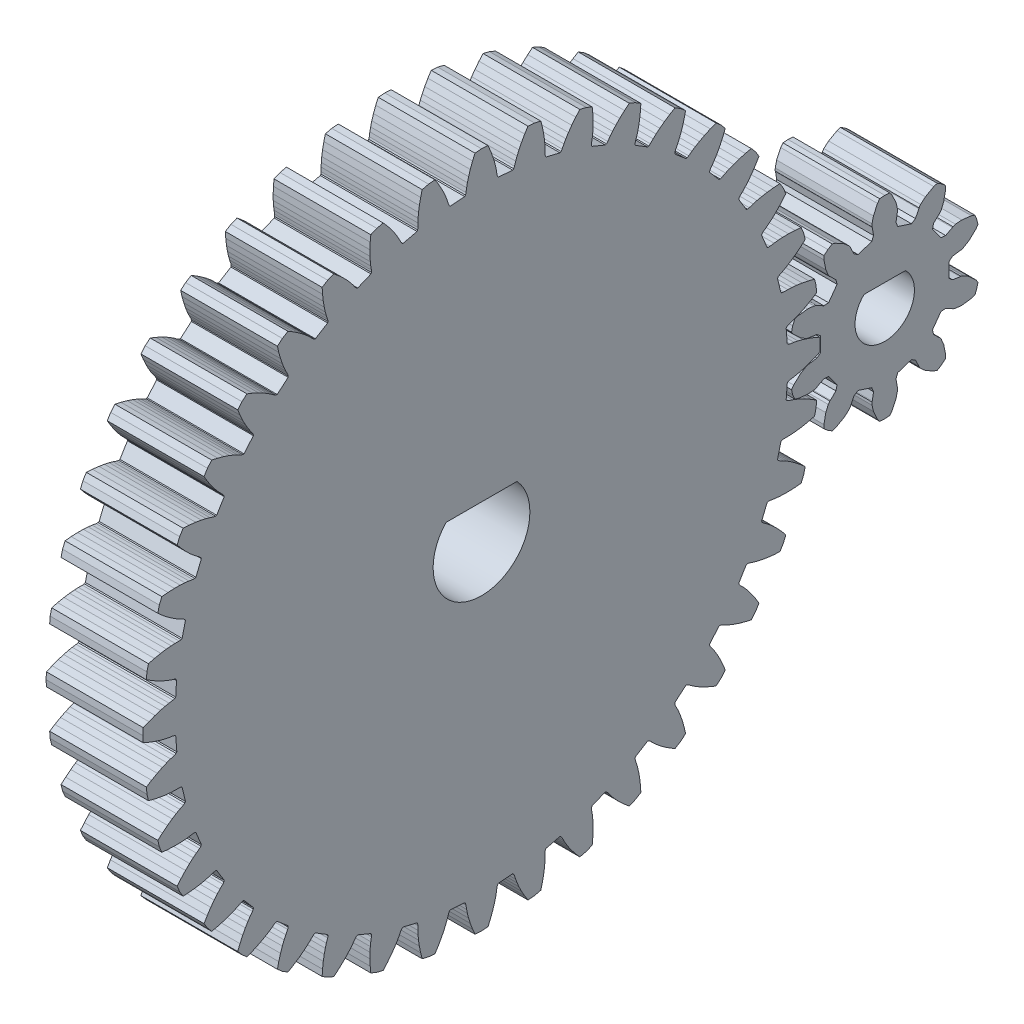
from build123d import *

# Parameters (mm, degrees)
BOSS_EXTRUDE1_DEPTH   = 6.35
BOSS_EXTRUDE1_2_DEPTH = 6.35


with BuildPart() as part:
    # Sketch1 → Boss-Extrude1 (new body)
    with BuildSketch(Plane(origin=(0, 0, 0), x_dir=(0, 0, -1), z_dir=(1, 0, 0))):
        Polygon((21.465245632, -3.994555744), (21.856281306, -3.89428781), (21.956333231, -3.47754155), (21.989959872, -3.050274559), (21.649047342, -2.834077419), (21.277026324, -2.624610686), (20.943763466, -2.459310064), (20.652727149, -2.333477623), (20.406996935, -2.242180601), (20.155632291, -2.163495755), (20.043799128, -2.107240426), (19.993019969, -2.048246673), (20.067289089, -1.104568025), (20.126671729, -1.054244194), (20.245928312, -1.016176023), (20.506507262, -0.977782011), (20.763494131, -0.926049682), (21.070631837, -0.847294558), (21.425650392, -0.736162857), (21.82585903, -0.587471917), (22.196395045, -0.427266991), (22.230021687, 0), (22.196395045, 0.427266991), (21.82585903, 0.587471917), (21.425650392, 0.736162857), (21.070631837, 0.847294558), (20.763494131, 0.926049682), (20.506507262, 0.977782011), (20.245928312, 1.016176023), (20.126671729, 1.054244194), (20.067289089, 1.104568025), (19.993019969, 2.048246673), (20.043799128, 2.107240426), (20.155632291, 2.163495755), (20.406996935, 2.242180601), (20.652727149, 2.333477623), (20.943763466, 2.459310064), (21.277026324, 2.624610686), (21.649047342, 2.834077419), (21.989959872, 3.050274559), (21.956333231, 3.47754155), (21.856281306, 3.89428781), (21.465245632, 3.994555744), (21.046703839, 4.078809628), (20.678671324, 4.133035975), (20.362994976, 4.162774571), (20.101079323, 4.173668386), (19.837702386, 4.170826175), (19.713958875, 4.189769823), (19.647434952, 4.230184593), (19.426456344, 5.150626741), (19.467381671, 5.216837794), (19.56903771, 5.289895087), (19.804998617, 5.406933286), (20.033421483, 5.535546964), (20.301190129, 5.705358309), (20.604491254, 5.920757604), (20.93916426, 6.185842363), (21.242058907, 6.452708226), (21.142006982, 6.869454486), (20.977993384, 7.265418339), (20.576086648, 7.303280351), (20.149517587, 7.321022569), (19.777533294, 7.31700833), (19.461091304, 7.296998134), (19.2006961, 7.266785193), (18.941006389, 7.222776744), (18.815822927, 7.222129415), (18.743795761, 7.251639978), (18.381548891, 8.126181285), (18.411612669, 8.197979301), (18.500588475, 8.286039646), (18.715335503, 8.438549329), (18.920826493, 8.601312768), (19.158734116, 8.810921699), (19.424605227, 9.07111582), (19.71368946, 9.385291338), (19.971107954, 9.696254802), (19.807094356, 10.092218655), (19.583157644, 10.457650156), (19.180276122, 10.432173959), (18.756183341, 10.382967637), (18.389406756, 10.320811657), (18.079990977, 10.251545385), (17.827528015, 10.180969631), (17.577919954, 10.096878578), (17.454378972, 10.076656211), (17.378622111, 10.094535919), (16.8840267, 10.901642276), (16.902488658, 10.977259351), (16.976593351, 11.078154409), (17.164838717, 11.262380281), (17.34233796, 11.455285706), (17.544526484, 11.699530954), (17.766420953, 11.998113059), (18.0027982, 12.353643292), (18.208402042, 12.701047404), (17.98446533, 13.066478905), (17.706119569, 13.392379919), (17.312183543, 13.30419282), (16.901009612, 13.189249583), (16.548471993, 13.070482347), (16.253701268, 12.953665566), (16.015387024, 12.844464809), (15.782006791, 12.722361753), (15.663150279, 12.683062289), (15.585529109, 12.688870884), (14.970763736, 13.408668654), (14.977169281, 13.486242844), (15.034578158, 13.597488244), (15.191686634, 13.808894053), (15.336823511, 14.027191491), (15.498314384, 14.300058928), (15.670768432, 14.629676935), (15.848618301, 15.017807549), (15.997344841, 15.393098067), (15.71899908, 15.71899908), (15.393098067, 15.997344841), (15.017807549, 15.848618301), (14.629676935, 15.670768432), (14.300058928, 15.498314384), (14.027191491, 15.336823511), (13.808894053, 15.191686634), (13.597488244, 15.034578158), (13.486242844, 14.977169281), (13.408668654, 14.970763736), (12.688870884, 15.585529109), (12.683062289, 15.663150279), (12.722361753, 15.782006791), (12.844464809, 16.015387024), (12.953665566, 16.253701268), (13.070482347, 16.548471993), (13.189249583, 16.901009612), (13.30419282, 17.312183543), (13.392379919, 17.706119569), (13.066478905, 17.98446533), (12.701047404, 18.208402042), (12.353643292, 18.0027982), (11.998113059, 17.766420953), (11.699530954, 17.544526484), (11.455285706, 17.34233796), (11.262380281, 17.164838717), (11.078154409, 16.976593351), (10.977259351, 16.902488658), (10.901642276, 16.8840267), (10.094535919, 17.378622111), (10.076656211, 17.454378972), (10.096878578, 17.577919954), (10.180969631, 17.827528015), (10.251545385, 18.079990977), (10.320811657, 18.389406756), (10.382967637, 18.756183341), (10.432173959, 19.180276122), (10.457650156, 19.583157644), (10.092218655, 19.807094356), (9.696254802, 19.971107954), (9.385291338, 19.71368946), (9.07111582, 19.424605227), (8.810921699, 19.158734116), (8.601312768, 18.920826493), (8.438549329, 18.715335503), (8.286039646, 18.500588475), (8.197979301, 18.411612669), (8.126181285, 18.381548891), (7.251639978, 18.743795761), (7.222129415, 18.815822927), (7.222776744, 18.941006389), (7.266785193, 19.2006961), (7.296998134, 19.461091304), (7.31700833, 19.777533294), (7.321022569, 20.149517587), (7.303280351, 20.576086648), (7.265418339, 20.977993384), (6.869454486, 21.142006982), (6.452708226, 21.242058907), (6.185842363, 20.93916426), (5.920757604, 20.604491254), (5.705358309, 20.301190129), (5.535546964, 20.033421483), (5.406933286, 19.804998617), (5.289895087, 19.56903771), (5.216837794, 19.467381671), (5.150626741, 19.426456344), (4.230184593, 19.647434952), (4.189769823, 19.713958875), (4.170826175, 19.837702386), (4.173668386, 20.101079323), (4.162774571, 20.362994976), (4.133035975, 20.678671324), (4.078809628, 21.046703839), (3.994555744, 21.465245632), (3.89428781, 21.856281306), (3.47754155, 21.956333231), (3.050274559, 21.989959872), (2.834077419, 21.649047342), (2.624610686, 21.277026324), (2.459310064, 20.943763466), (2.333477623, 20.652727149), (2.242180601, 20.406996935), (2.163495755, 20.155632291), (2.107240426, 20.043799128), (2.048246673, 19.993019969), (1.104568025, 20.067289089), (1.054244194, 20.126671729), (1.016176023, 20.245928312), (0.977782011, 20.506507262), (0.926049682, 20.763494131), (0.847294558, 21.070631837), (0.736162857, 21.425650392), (0.587471917, 21.82585903), (0.427266991, 22.196395045), (0, 22.230021687), (-0.427266991, 22.196395045), (-0.587471917, 21.82585903), (-0.736162857, 21.425650392), (-0.847294558, 21.070631837), (-0.926049682, 20.763494131), (-0.977782011, 20.506507262), (-1.016176023, 20.245928312), (-1.054244194, 20.126671729), (-1.104568025, 20.067289089), (-2.048246673, 19.993019969), (-2.107240426, 20.043799128), (-2.163495755, 20.155632291), (-2.242180601, 20.406996935), (-2.333477623, 20.652727149), (-2.459310064, 20.943763466), (-2.624610686, 21.277026324), (-2.834077419, 21.649047342), (-3.050274559, 21.989959872), (-3.47754155, 21.956333231), (-3.89428781, 21.856281306), (-3.994555744, 21.465245632), (-4.078809628, 21.046703839), (-4.133035975, 20.678671324), (-4.162774571, 20.362994976), (-4.173668386, 20.101079323), (-4.170826175, 19.837702386), (-4.189769823, 19.713958875), (-4.230184593, 19.647434952), (-5.150626741, 19.426456344), (-5.216837794, 19.467381671), (-5.289895087, 19.56903771), (-5.406933286, 19.804998617), (-5.535546964, 20.033421483), (-5.705358309, 20.301190129), (-5.920757604, 20.604491254), (-6.185842363, 20.93916426), (-6.452708226, 21.242058907), (-6.869454486, 21.142006982), (-7.265418339, 20.977993384), (-7.303280351, 20.576086648), (-7.321022569, 20.149517587), (-7.31700833, 19.777533294), (-7.296998134, 19.461091304), (-7.266785193, 19.2006961), (-7.222776744, 18.941006389), (-7.222129415, 18.815822927), (-7.251639978, 18.743795761), (-8.126181285, 18.381548891), (-8.197979301, 18.411612669), (-8.286039646, 18.500588475), (-8.438549329, 18.715335503), (-8.601312768, 18.920826493), (-8.810921699, 19.158734116), (-9.07111582, 19.424605227), (-9.385291338, 19.71368946), (-9.696254802, 19.971107954), (-10.092218655, 19.807094356), (-10.457650156, 19.583157644), (-10.432173959, 19.180276122), (-10.382967637, 18.756183341), (-10.320811657, 18.389406756), (-10.251545385, 18.079990977), (-10.180969631, 17.827528015), (-10.096878578, 17.577919954), (-10.076656211, 17.454378972), (-10.094535919, 17.378622111), (-10.901642276, 16.8840267), (-10.977259351, 16.902488658), (-11.078154409, 16.976593351), (-11.262380281, 17.164838717), (-11.455285706, 17.34233796), (-11.699530954, 17.544526484), (-11.998113059, 17.766420953), (-12.353643292, 18.0027982), (-12.701047404, 18.208402042), (-13.066478905, 17.98446533), (-13.392379919, 17.706119569), (-13.30419282, 17.312183543), (-13.189249583, 16.901009612), (-13.070482347, 16.548471993), (-12.953665566, 16.253701268), (-12.844464809, 16.015387024), (-12.722361753, 15.782006791), (-12.683062289, 15.663150279), (-12.688870884, 15.585529109), (-13.408668654, 14.970763736), (-13.486242844, 14.977169281), (-13.597488244, 15.034578158), (-13.808894053, 15.191686634), (-14.027191491, 15.336823511), (-14.300058928, 15.498314384), (-14.629676935, 15.670768432), (-15.017807549, 15.848618301), (-15.393098067, 15.997344841), (-15.71899908, 15.71899908), (-15.997344841, 15.393098067), (-15.848618301, 15.017807549), (-15.670768432, 14.629676935), (-15.498314384, 14.300058928), (-15.336823511, 14.027191491), (-15.191686634, 13.808894053), (-15.034578158, 13.597488244), (-14.977169281, 13.486242844), (-14.970763736, 13.408668654), (-15.585529109, 12.688870884), (-15.663150279, 12.683062289), (-15.782006791, 12.722361753), (-16.015387024, 12.844464809), (-16.253701268, 12.953665566), (-16.548471993, 13.070482347), (-16.901009612, 13.189249583), (-17.312183543, 13.30419282), (-17.706119569, 13.392379919), (-17.98446533, 13.066478905), (-18.208402042, 12.701047404), (-18.0027982, 12.353643292), (-17.766420953, 11.998113059), (-17.544526484, 11.699530954), (-17.34233796, 11.455285706), (-17.164838717, 11.262380281), (-16.976593351, 11.078154409), (-16.902488658, 10.977259351), (-16.8840267, 10.901642276), (-17.378622111, 10.094535919), (-17.454378972, 10.076656211), (-17.577919954, 10.096878578), (-17.827528015, 10.180969631), (-18.079990977, 10.251545385), (-18.389406756, 10.320811657), (-18.756183341, 10.382967637), (-19.180276122, 10.432173959), (-19.583157644, 10.457650156), (-19.807094356, 10.092218655), (-19.971107954, 9.696254802), (-19.71368946, 9.385291338), (-19.424605227, 9.07111582), (-19.158734116, 8.810921699), (-18.920826493, 8.601312768), (-18.715335503, 8.438549329), (-18.500588475, 8.286039646), (-18.411612669, 8.197979301), (-18.381548891, 8.126181285), (-18.743795761, 7.251639978), (-18.815822927, 7.222129415), (-18.941006389, 7.222776744), (-19.2006961, 7.266785193), (-19.461091304, 7.296998134), (-19.777533294, 7.31700833), (-20.149517587, 7.321022569), (-20.576086648, 7.303280351), (-20.977993384, 7.265418339), (-21.142006982, 6.869454486), (-21.242058907, 6.452708226), (-20.93916426, 6.185842363), (-20.604491254, 5.920757604), (-20.301190129, 5.705358309), (-20.033421483, 5.535546964), (-19.804998617, 5.406933286), (-19.56903771, 5.289895087), (-19.467381671, 5.216837794), (-19.426456344, 5.150626741), (-19.647434952, 4.230184593), (-19.713958875, 4.189769823), (-19.837702386, 4.170826175), (-20.101079323, 4.173668386), (-20.362994976, 4.162774571), (-20.678671324, 4.133035975), (-21.046703839, 4.078809628), (-21.465245632, 3.994555744), (-21.856281306, 3.89428781), (-21.956333231, 3.47754155), (-21.989959872, 3.050274559), (-21.649047342, 2.834077419), (-21.277026324, 2.624610686), (-20.943763466, 2.459310064), (-20.652727149, 2.333477623), (-20.406996935, 2.242180601), (-20.155632291, 2.163495755), (-20.043799128, 2.107240426), (-20.016196867, 2.015576433), (-20.067289089, 1.104568025), (-20.126671729, 1.054244194), (-20.245928312, 1.016176023), (-20.506507262, 0.977782011), (-20.763494131, 0.926049682), (-21.070631837, 0.847294558), (-21.425650392, 0.736162857), (-21.82585903, 0.587471917), (-22.196395045, 0.427266991), (-22.230021687, 0), (-22.196395045, -0.427266991), (-21.82585903, -0.587471917), (-21.425650392, -0.736162857), (-21.070631837, -0.847294558), (-20.763494131, -0.926049682), (-20.506507262, -0.977782011), (-20.245928312, -1.016176023), (-20.126671729, -1.054244194), (-20.067289089, -1.104568025), (-19.993019969, -2.048246673), (-20.043799128, -2.107240426), (-20.155632291, -2.163495755), (-20.406996935, -2.242180601), (-20.652727149, -2.333477623), (-20.943763466, -2.459310064), (-21.277026324, -2.624610686), (-21.649047342, -2.834077419), (-21.989959872, -3.050274559), (-21.956333231, -3.47754155), (-21.856281306, -3.89428781), (-21.465245632, -3.994555744), (-21.046703839, -4.078809628), (-20.678671324, -4.133035975), (-20.362994976, -4.162774571), (-20.101079323, -4.173668386), (-19.837702386, -4.170826175), (-19.713958875, -4.189769823), (-19.647434952, -4.230184593), (-19.426456344, -5.150626741), (-19.467381671, -5.216837794), (-19.56903771, -5.289895087), (-19.804998617, -5.406933286), (-20.033421483, -5.535546964), (-20.301190129, -5.705358309), (-20.604491254, -5.920757604), (-20.93916426, -6.185842363), (-21.242058907, -6.452708226), (-21.142006982, -6.869454486), (-20.977993384, -7.265418339), (-20.576086648, -7.303280351), (-20.149517587, -7.321022569), (-19.777533294, -7.31700833), (-19.461091304, -7.296998134), (-19.2006961, -7.266785193), (-18.941006389, -7.222776744), (-18.815822927, -7.222129415), (-18.743795761, -7.251639978), (-18.381548891, -8.126181285), (-18.411612669, -8.197979301), (-18.500588475, -8.286039646), (-18.715335503, -8.438549329), (-18.920826493, -8.601312768), (-19.158734116, -8.810921699), (-19.424605227, -9.07111582), (-19.71368946, -9.385291338), (-19.971107954, -9.696254802), (-19.807094356, -10.092218655), (-19.583157644, -10.457650156), (-19.180276122, -10.432173959), (-18.756183341, -10.382967637), (-18.389406756, -10.320811657), (-18.079990977, -10.251545385), (-17.827528015, -10.180969631), (-17.577919954, -10.096878578), (-17.454378972, -10.076656211), (-17.378622111, -10.094535919), (-16.8840267, -10.901642276), (-16.902488658, -10.977259351), (-16.976593351, -11.078154409), (-17.164838717, -11.262380281), (-17.34233796, -11.455285706), (-17.544526484, -11.699530954), (-17.766420953, -11.998113059), (-18.0027982, -12.353643292), (-18.208402042, -12.701047404), (-17.98446533, -13.066478905), (-17.706119569, -13.392379919), (-17.312183543, -13.30419282), (-16.901009612, -13.189249583), (-16.548471993, -13.070482347), (-16.253701268, -12.953665566), (-16.015387024, -12.844464809), (-15.782006791, -12.722361753), (-15.663150279, -12.683062289), (-15.585529109, -12.688870884), (-14.970763736, -13.408668654), (-14.977169281, -13.486242844), (-15.034578158, -13.597488244), (-15.191686634, -13.808894053), (-15.336823511, -14.027191491), (-15.498314384, -14.300058928), (-15.670768432, -14.629676935), (-15.848618301, -15.017807549), (-15.997344841, -15.393098067), (-15.71899908, -15.71899908), (-15.393098067, -15.997344841), (-15.017807549, -15.848618301), (-14.629676935, -15.670768432), (-14.300058928, -15.498314384), (-14.027191491, -15.336823511), (-13.808894053, -15.191686634), (-13.597488244, -15.034578158), (-13.486242844, -14.977169281), (-13.408668654, -14.970763736), (-12.688870884, -15.585529109), (-12.683062289, -15.663150279), (-12.722361753, -15.782006791), (-12.844464809, -16.015387024), (-12.953665566, -16.253701268), (-13.070482347, -16.548471993), (-13.189249583, -16.901009612), (-13.30419282, -17.312183543), (-13.392379919, -17.706119569), (-13.066478905, -17.98446533), (-12.701047404, -18.208402042), (-12.353643292, -18.0027982), (-11.998113059, -17.766420953), (-11.699530954, -17.544526484), (-11.455285706, -17.34233796), (-11.262380281, -17.164838717), (-11.078154409, -16.976593351), (-10.977259351, -16.902488658), (-10.901642276, -16.8840267), (-10.094535919, -17.378622111), (-10.076656211, -17.454378972), (-10.096878578, -17.577919954), (-10.180969631, -17.827528015), (-10.251545385, -18.079990977), (-10.320811657, -18.389406756), (-10.382967637, -18.756183341), (-10.432173959, -19.180276122), (-10.457650156, -19.583157644), (-10.092218655, -19.807094356), (-9.696254802, -19.971107954), (-9.385291338, -19.71368946), (-9.07111582, -19.424605227), (-8.810921699, -19.158734116), (-8.601312768, -18.920826493), (-8.438549329, -18.715335503), (-8.286039646, -18.500588475), (-8.197979301, -18.411612669), (-8.126181285, -18.381548891), (-7.251639978, -18.743795761), (-7.222129415, -18.815822927), (-7.222776744, -18.941006389), (-7.266785193, -19.2006961), (-7.296998134, -19.461091304), (-7.31700833, -19.777533294), (-7.321022569, -20.149517587), (-7.303280351, -20.576086648), (-7.265418339, -20.977993384), (-6.869454486, -21.142006982), (-6.452708226, -21.242058907), (-6.185842363, -20.93916426), (-5.920757604, -20.604491254), (-5.705358309, -20.301190129), (-5.535546964, -20.033421483), (-5.406933286, -19.804998617), (-5.289895087, -19.56903771), (-5.216837794, -19.467381671), (-5.150626741, -19.426456344), (-4.230184593, -19.647434952), (-4.189769823, -19.713958875), (-4.170826175, -19.837702386), (-4.173668386, -20.101079323), (-4.162774571, -20.362994976), (-4.133035975, -20.678671324), (-4.078809628, -21.046703839), (-3.994555744, -21.465245632), (-3.89428781, -21.856281306), (-3.47754155, -21.956333231), (-3.050274559, -21.989959872), (-2.834077419, -21.649047342), (-2.624610686, -21.277026324), (-2.459310064, -20.943763466), (-2.333477623, -20.652727149), (-2.242180601, -20.406996935), (-2.163495755, -20.155632291), (-2.107240426, -20.043799128), (-2.048246673, -19.993019969), (-1.104568025, -20.067289089), (-1.054244194, -20.126671729), (-1.016176023, -20.245928312), (-0.977782011, -20.506507262), (-0.926049682, -20.763494131), (-0.847294558, -21.070631837), (-0.736162857, -21.425650392), (-0.587471917, -21.82585903), (-0.427266991, -22.196395045), (0, -22.230021687), (0.427266991, -22.196395045), (0.587471917, -21.82585903), (0.736162857, -21.425650392), (0.847294558, -21.070631837), (0.926049682, -20.763494131), (0.977782011, -20.506507262), (1.016176023, -20.245928312), (1.054244194, -20.126671729), (1.104568025, -20.067289089), (2.048246673, -19.993019969), (2.107240426, -20.043799128), (2.163495755, -20.155632291), (2.242180601, -20.406996935), (2.333477623, -20.652727149), (2.459310064, -20.943763466), (2.624610686, -21.277026324), (2.834077419, -21.649047342), (3.050274559, -21.989959872), (3.47754155, -21.956333231), (3.89428781, -21.856281306), (3.994555744, -21.465245632), (4.078809628, -21.046703839), (4.133035975, -20.678671324), (4.162774571, -20.362994976), (4.173668386, -20.101079323), (4.170826175, -19.837702386), (4.189769823, -19.713958875), (4.230184593, -19.647434952), (5.150626741, -19.426456344), (5.216837794, -19.467381671), (5.289895087, -19.56903771), (5.406933286, -19.804998617), (5.535546964, -20.033421483), (5.705358309, -20.301190129), (5.920757604, -20.604491254), (6.185842363, -20.93916426), (6.452708226, -21.242058907), (6.869454486, -21.142006982), (7.265418339, -20.977993384), (7.303280351, -20.576086648), (7.321022569, -20.149517587), (7.31700833, -19.777533294), (7.296998134, -19.461091304), (7.266785193, -19.2006961), (7.222776744, -18.941006389), (7.222129415, -18.815822927), (7.251639978, -18.743795761), (8.126181285, -18.381548891), (8.197979301, -18.411612669), (8.286039646, -18.500588475), (8.438549329, -18.715335503), (8.601312768, -18.920826493), (8.810921699, -19.158734116), (9.07111582, -19.424605227), (9.385291338, -19.71368946), (9.696254802, -19.971107954), (10.092218655, -19.807094356), (10.457650156, -19.583157644), (10.432173959, -19.180276122), (10.382967637, -18.756183341), (10.320811657, -18.389406756), (10.251545385, -18.079990977), (10.180969631, -17.827528015), (10.096878578, -17.577919954), (10.076656211, -17.454378972), (10.094535919, -17.378622111), (10.901642276, -16.8840267), (10.977259351, -16.902488658), (11.078154409, -16.976593351), (11.262380281, -17.164838717), (11.455285706, -17.34233796), (11.699530954, -17.544526484), (11.998113059, -17.766420953), (12.353643292, -18.0027982), (12.701047404, -18.208402042), (13.066478905, -17.98446533), (13.392379919, -17.706119569), (13.30419282, -17.312183543), (13.189249583, -16.901009612), (13.070482347, -16.548471993), (12.953665566, -16.253701268), (12.844464809, -16.015387024), (12.722361753, -15.782006791), (12.683062289, -15.663150279), (12.688870884, -15.585529109), (13.408668654, -14.970763736), (13.486242844, -14.977169281), (13.597488244, -15.034578158), (13.808894053, -15.191686634), (14.027191491, -15.336823511), (14.300058928, -15.498314384), (14.629676935, -15.670768432), (15.017807549, -15.848618301), (15.393098067, -15.997344841), (15.71899908, -15.71899908), (15.997344841, -15.393098067), (15.848618301, -15.017807549), (15.670768432, -14.629676935), (15.498314384, -14.300058928), (15.336823511, -14.027191491), (15.191686634, -13.808894053), (15.034578158, -13.597488244), (14.977169281, -13.486242844), (14.970763736, -13.408668654), (15.585529109, -12.688870884), (15.663150279, -12.683062289), (15.782006791, -12.722361753), (16.015387024, -12.844464809), (16.253701268, -12.953665566), (16.548471993, -13.070482347), (16.901009612, -13.189249583), (17.312183543, -13.30419282), (17.706119569, -13.392379919), (17.98446533, -13.066478905), (18.208402042, -12.701047404), (18.0027982, -12.353643292), (17.766420953, -11.998113059), (17.544526484, -11.699530954), (17.34233796, -11.455285706), (17.164838717, -11.262380281), (16.976593351, -11.078154409), (16.902488658, -10.977259351), (16.8840267, -10.901642276), (17.378622111, -10.094535919), (17.454378972, -10.076656211), (17.577919954, -10.096878578), (17.827528015, -10.180969631), (18.079990977, -10.251545385), (18.389406756, -10.320811657), (18.756183341, -10.382967637), (19.180276122, -10.432173959), (19.583157644, -10.457650156), (19.807094356, -10.092218655), (19.971107954, -9.696254802), (19.71368946, -9.385291338), (19.424605227, -9.07111582), (19.158734116, -8.810921699), (18.920826493, -8.601312768), (18.715335503, -8.438549329), (18.500588475, -8.286039646), (18.411612669, -8.197979301), (18.381548891, -8.126181285), (18.743795761, -7.251639978), (18.815822927, -7.222129415), (18.941006389, -7.222776744), (19.2006961, -7.266785193), (19.461091304, -7.296998134), (19.777533294, -7.31700833), (20.149517587, -7.321022569), (20.576086648, -7.303280351), (20.977993384, -7.265418339), (21.142006982, -6.869454486), (21.242058907, -6.452708226), (20.93916426, -6.185842363), (20.604491254, -5.920757604), (20.301190129, -5.705358309), (20.033421483, -5.535546964), (19.804998617, -5.406933286), (19.56903771, -5.289895087), (19.467381671, -5.216837794), (19.426456344, -5.150626741), (19.647434952, -4.230184593), (19.713958875, -4.189769823), (19.837702386, -4.170826175), (20.101079323, -4.173668386), (20.362994976, -4.162774571), (20.678671324, -4.133035975), (21.046703839, -4.078809628), align=None)
        with BuildLine():
            ThreePointArc((2.327948453, 2.159), (0, -3.175), (-2.327948453, 2.159))
            Line((-2.327948453, 2.159), (2.327948453, 2.159))
        make_face(mode=Mode.SUBTRACT)
    extrude(amount=BOSS_EXTRUDE1_DEPTH)


with BuildPart() as body_2:
    # Sketch1 → Boss-Extrude1 2 (new body)
    with BuildSketch(Plane(origin=(0, 0, 0), x_dir=(0, 0, -1), z_dir=(1, 0, 0))):
        Polygon((20.780283312, 2.3493565), (20.55148177, 2.271101764), (20.423738108, 1.962701282), (20.345811647, 1.63811421), (20.484919002, 1.440318627), (20.949094267, 1.009256228), (21.303523371, 0.797288328), (21.472120418, 0.739624741), (21.520812366, 0.74398604), (22.014000359, 0.671229079), (22.250806708, 0.473298345), (22.250806708, -0.473298345), (22.014000359, -0.671229079), (21.520812366, -0.74398604), (21.472120418, -0.739624741), (21.303523371, -0.797288328), (20.949094267, -1.009256228), (20.484919002, -1.440318627), (20.345811647, -1.63811421), (20.423738108, -1.962701282), (20.55148177, -2.271101764), (20.780283312, -2.3493565), (21.40918111, -2.425257932), (21.820511885, -2.388415364), (21.990803566, -2.335967328), (22.027632672, -2.303818554), (22.469395609, -2.072791543), (22.777316737, -2.093729591), (23.333712311, -2.8595424), (23.258472716, -3.158863008), (22.902240717, -3.507613254), (22.860284597, -3.532705299), (22.757780526, -3.678454977), (22.595632963, -4.058268811), (22.473479407, -4.679840993), (22.477200519, -4.921626233), (22.731031844, -5.138418666), (23.015651893, -5.312834056), (23.246753209, -5.241657295), (23.800155957, -4.933405993), (24.111274026, -4.661825566), (24.218214708, -4.519299275), (24.229113506, -4.471642765), (24.450712959, -4.025076248), (24.71213346, -3.861023987), (25.61240041, -4.153538451), (25.727466539, -4.439918633), (25.644259049, -4.931451425), (25.625064568, -4.976412504), (25.627806545, -5.154576852), (25.719875381, -5.557160645), (25.986402039, -6.131823161), (26.131530281, -6.325244315), (26.464311532, -6.351434768), (26.797092782, -6.325244315), (26.942221024, -6.131823161), (27.208747682, -5.557160645), (27.300816518, -5.154576852), (27.303558495, -4.976412504), (27.284364014, -4.931451425), (27.201156524, -4.439918633), (27.316222653, -4.153538451), (28.216489603, -3.861023987), (28.477910104, -4.025076248), (28.699509557, -4.471642765), (28.710408355, -4.519299275), (28.817349037, -4.661825566), (29.128467106, -4.933405993), (29.681869855, -5.241657295), (29.91297117, -5.312834056), (30.197591219, -5.138418666), (30.451422544, -4.921626233), (30.455143656, -4.679840993), (30.3329901, -4.058268811), (30.170842537, -3.678454977), (30.068338466, -3.532705299), (30.026382346, -3.507613254), (29.670150347, -3.158863008), (29.594910753, -2.8595424), (30.151306327, -2.093729591), (30.459227454, -2.072791543), (30.900990391, -2.303818554), (30.937819497, -2.335967328), (31.108111178, -2.388415364), (31.519441953, -2.425257932), (32.148339751, -2.3493565), (32.377141293, -2.271101764), (32.504884955, -1.962701282), (32.582811417, -1.63811421), (32.443704061, -1.440318627), (31.979528796, -1.009256228), (31.625099692, -0.797288328), (31.456502645, -0.739624741), (31.407810697, -0.74398604), (30.914622704, -0.671229079), (30.677816355, -0.473298345), (30.677816355, 0.473298345), (30.914622704, 0.671229079), (31.407810697, 0.74398604), (31.456502645, 0.739624741), (31.625099692, 0.797288328), (31.979528796, 1.009256228), (32.443704061, 1.440318627), (32.582811417, 1.63811421), (32.504884955, 1.962701282), (32.377141293, 2.271101764), (32.148339751, 2.3493565), (31.519441953, 2.425257932), (31.108111178, 2.388415364), (30.937819497, 2.335967328), (30.900990391, 2.303818554), (30.459227454, 2.072791543), (30.151306327, 2.093729591), (29.594910753, 2.8595424), (29.670150347, 3.158863008), (30.026382346, 3.507613254), (30.068338466, 3.532705299), (30.170842537, 3.678454977), (30.3329901, 4.058268811), (30.455143656, 4.679840993), (30.451422544, 4.921626233), (30.197591219, 5.138418666), (29.91297117, 5.312834056), (29.681869855, 5.241657295), (29.128467106, 4.933405993), (28.817349037, 4.661825566), (28.710408355, 4.519299275), (28.699509557, 4.471642765), (28.477910104, 4.025076248), (28.216489603, 3.861023987), (27.316222653, 4.153538451), (27.201156524, 4.439918633), (27.284364014, 4.931451425), (27.303558495, 4.976412504), (27.300816518, 5.154576852), (27.208747682, 5.557160645), (26.942221024, 6.131823161), (26.797092782, 6.325244315), (26.464311532, 6.351434768), (26.131530281, 6.325244315), (25.986402039, 6.131823161), (25.719875381, 5.557160645), (25.627806545, 5.154576852), (25.625064568, 4.976412504), (25.644259049, 4.931451425), (25.727466539, 4.439918633), (25.61240041, 4.153538451), (24.71213346, 3.861023987), (24.450712959, 4.025076248), (24.229113506, 4.471642765), (24.218214708, 4.519299275), (24.111274026, 4.661825566), (23.800155957, 4.933405993), (23.246753209, 5.241657295), (23.015651893, 5.312834056), (22.731031844, 5.138418666), (22.477200519, 4.921626233), (22.473479407, 4.679840993), (22.595632963, 4.058268811), (22.757780526, 3.678454977), (22.860284597, 3.532705299), (22.902240717, 3.507613254), (23.258472716, 3.158863008), (23.333712311, 2.8595424), (22.777316737, 2.093729591), (22.469395609, 2.072791543), (22.027632672, 2.303818554), (21.990803566, 2.335967328), (21.820511885, 2.388415364), (21.40918111, 2.425257932), align=None)
        with BuildLine():
            ThreePointArc((27.822300148, 1.398435254), (26.461825598, -1.948564746), (25.101351049, 1.398435254))
            Line((25.101351049, 1.398435254), (27.822300148, 1.398435254))
        make_face(mode=Mode.SUBTRACT)
    extrude(amount=BOSS_EXTRUDE1_2_DEPTH)


solid = Compound([part.part, body_2.part])
